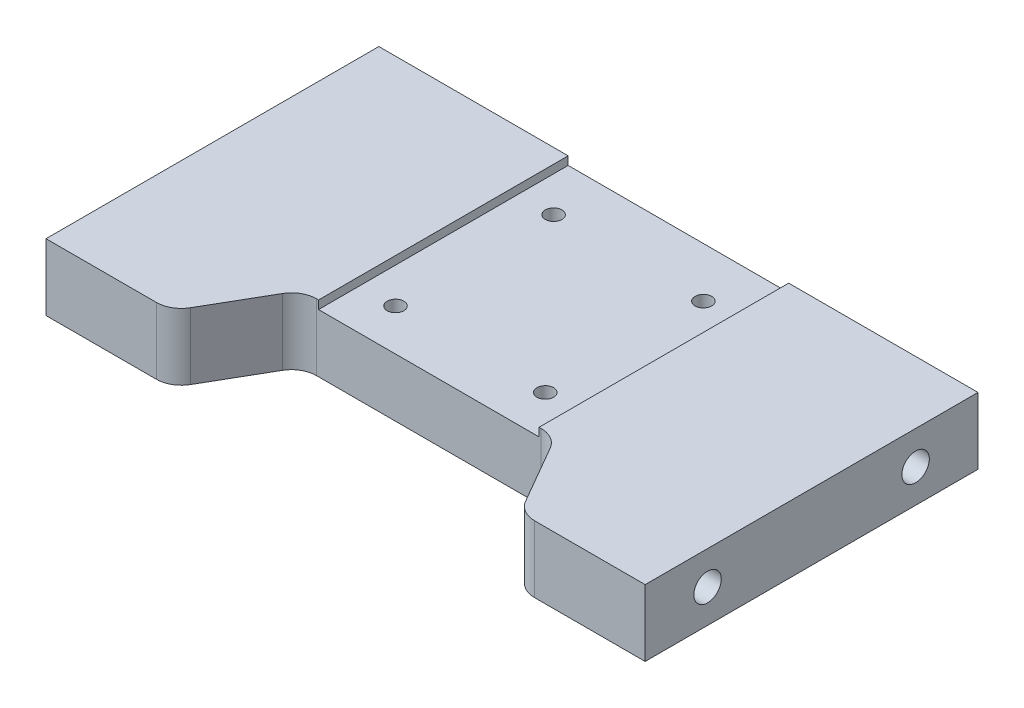
from build123d import *

# Parameters (mm, degrees)
SKETCH1_W                   = 72
SKETCH1_H                   = 40
BOSS_EXTRUDE1_DEPTH         = 8
CUT_EXTRUDE3_REACH          = 84.753
CUT_EXTRUDE4_REACH          = 84.753
SKETCH5_R                   = 1
FILLET1_R                   = 3
TAP_DRILL_FOR_M4_TAP1_D     = 3.3
TAP_DRILL_FOR_M4_TAP1_DEPTH = 10
TAP_DRILL_FOR_M4_TAP1_TIP   = 0.991420021
TAP_DRILL_FOR_M4_TAP2_D     = 3.3
TAP_DRILL_FOR_M4_TAP2_DEPTH = 10
TAP_DRILL_FOR_M4_TAP2_TIP   = 0.991420021
SKETCH10_W                  = 26.5
SKETCH10_H                  = 30
CUT_EXTRUDE5_DEPTH          = 1


with BuildPart() as part:
    # Sketch1 → Boss-Extrude1 (new body)
    with BuildSketch(Plane(origin=(0, 0, 0), x_dir=(1, 0, 0), z_dir=(0, 1, 0))):
        with Locations((36, 20)):
            Rectangle(SKETCH1_W, SKETCH1_H)
    extrude(amount=BOSS_EXTRUDE1_DEPTH)

    # Sketch4 → Cut-Extrude3 (cut, up to next)
    with BuildSketch(Plane(origin=(0, 8, 0), x_dir=(1, 0, 0), z_dir=(0, 1, 0)), mode=Mode.PRIVATE) as cut_extrude3_sk1:
        Polygon((15, 0), (57, 0), (51.226497308, 10), (20.773502692, 10), align=None)
    cut_extrude3_tool1 = extrude(cut_extrude3_sk1.sketch, amount=-CUT_EXTRUDE3_REACH, mode=Mode.PRIVATE) & part.part
    add(cut_extrude3_tool1.solids().sort_by_distance((36, 8, -4.734379))[0], mode=Mode.SUBTRACT)

    # Sketch5 → Cut-Extrude4 (cut, up to next)
    with BuildSketch(Plane(origin=(0, 8, 0), x_dir=(1, 0, 0), z_dir=(0, 1, 0)), mode=Mode.PRIVATE) as cut_extrude4_sk1:
        with Locations((27, 15)):
            Circle(SKETCH5_R)
    cut_extrude4_tool1 = extrude(cut_extrude4_sk1.sketch, amount=-CUT_EXTRUDE4_REACH, mode=Mode.PRIVATE) & part.part
    # Sketch5 → Cut-Extrude4 (cut, up to next)
    with BuildSketch(Plane(origin=(0, 8, 0), x_dir=(1, 0, 0), z_dir=(0, 1, 0)), mode=Mode.PRIVATE) as cut_extrude4_sk2:
        with Locations((45, 15)):
            Circle(SKETCH5_R)
    cut_extrude4_tool2 = extrude(cut_extrude4_sk2.sketch, amount=-CUT_EXTRUDE4_REACH, mode=Mode.PRIVATE) & part.part
    # Sketch5 → Cut-Extrude4 (cut, up to next)
    with BuildSketch(Plane(origin=(0, 8, 0), x_dir=(1, 0, 0), z_dir=(0, 1, 0)), mode=Mode.PRIVATE) as cut_extrude4_sk3:
        with Locations((45, 34)):
            Circle(SKETCH5_R)
    cut_extrude4_tool3 = extrude(cut_extrude4_sk3.sketch, amount=-CUT_EXTRUDE4_REACH, mode=Mode.PRIVATE) & part.part
    # Sketch5 → Cut-Extrude4 (cut, up to next)
    with BuildSketch(Plane(origin=(0, 8, 0), x_dir=(1, 0, 0), z_dir=(0, 1, 0)), mode=Mode.PRIVATE) as cut_extrude4_sk4:
        with Locations((27, 34)):
            Circle(SKETCH5_R)
    cut_extrude4_tool4 = extrude(cut_extrude4_sk4.sketch, amount=-CUT_EXTRUDE4_REACH, mode=Mode.PRIVATE) & part.part
    add(cut_extrude4_tool1.solids().sort_by_distance((27, 8, -15))[0], mode=Mode.SUBTRACT)
    add(cut_extrude4_tool2.solids().sort_by_distance((45, 8, -15))[0], mode=Mode.SUBTRACT)
    add(cut_extrude4_tool3.solids().sort_by_distance((45, 8, -34))[0], mode=Mode.SUBTRACT)
    add(cut_extrude4_tool4.solids().sort_by_distance((27, 8, -34))[0], mode=Mode.SUBTRACT)

    # Fillet1
    fillet1_edges = [part.edges().sort_by_distance(p)[0] for p in [
        (57, 4, 0),
        (51.226497308, 4, -10),
        (20.773502692, 4, -10),
        (15, 4, 0),
    ]]
    fillet(fillet1_edges, radius=FILLET1_R)

    # Tap Drill for M4 Tap1
    with Locations(Plane.ZY):
        with Locations((-32.5, 4), (-7.5, 4)):
            Hole(TAP_DRILL_FOR_M4_TAP1_D / 2, depth=TAP_DRILL_FOR_M4_TAP1_DEPTH)
            with Locations((0, 0, -(TAP_DRILL_FOR_M4_TAP1_DEPTH + TAP_DRILL_FOR_M4_TAP1_TIP / 2))):  # 118° drill point
                Cone(0, TAP_DRILL_FOR_M4_TAP1_D / 2, TAP_DRILL_FOR_M4_TAP1_TIP, mode=Mode.SUBTRACT)

    # Tap Drill for M4 Tap2
    with Locations(Plane(origin=(72, 0, 0), x_dir=(0, 0, -1), z_dir=(1, 0, 0))):
        with Locations((7.5, 4), (32.5, 4)):
            Hole(TAP_DRILL_FOR_M4_TAP2_D / 2, depth=TAP_DRILL_FOR_M4_TAP2_DEPTH)
            with Locations((0, 0, -(TAP_DRILL_FOR_M4_TAP2_DEPTH + TAP_DRILL_FOR_M4_TAP2_TIP / 2))):  # 118° drill point
                Cone(0, TAP_DRILL_FOR_M4_TAP2_D / 2, TAP_DRILL_FOR_M4_TAP2_TIP, mode=Mode.SUBTRACT)

    # Sketch10 → Cut-Extrude5 (cut)
    with BuildSketch(Plane(origin=(0, 8, 0), x_dir=(1, 0, 0), z_dir=(0, 1, 0))):
        with Locations((36, 25)):
            Rectangle(SKETCH10_W, SKETCH10_H)
    extrude(amount=-CUT_EXTRUDE5_DEPTH, mode=Mode.SUBTRACT)


solid = part.part
